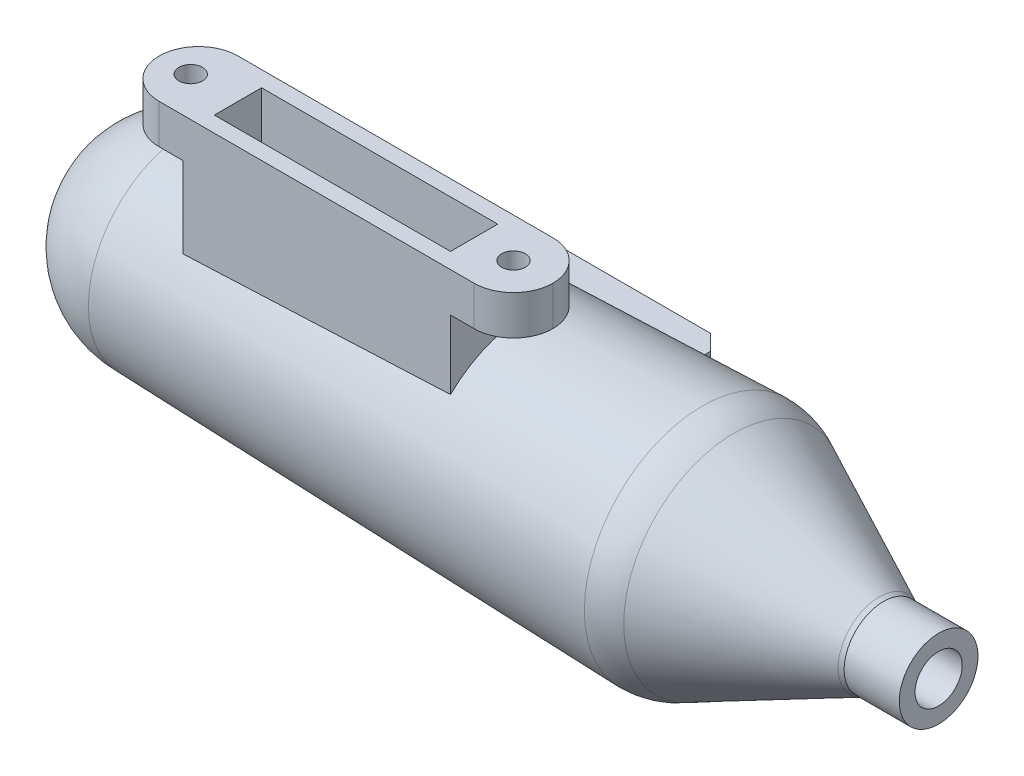
from build123d import *

# Parameters (mm, degrees)
BOSS_EXTRUDE1_REACH = 70.28
SKETCH2_W           = 34
SKETCH2_H           = 10
SKETCH2_W_2         = 30
SKETCH2_H_2         = 6
SKETCH4_W           = 30
SKETCH4_H           = 6
CUT_EXTRUDE4_DEPTH  = 20
SKETCH5_W           = 50
SKETCH5_H           = 10
SKETCH5_R           = 1.5
SKETCH5_W_2         = 30
SKETCH5_H_2         = 6
BOSS_EXTRUDE2_DEPTH = 5
FILLET1_R           = 5
BOSS_EXTRUDE3_REACH = 69.202
SKETCH6_W           = 49
SKETCH6_H           = 1
CHAMFER1_SIZE       = 2


with BuildPart() as part:
    # Sketch1 → Revolve1 (revolve)
    with BuildSketch(Plane.XY, mode=Mode.PRIVATE) as revolve1_sk:
        with BuildLine():
            Line((-41, 13), (24, 15))
            ThreePointArc((24, 15), (26.065530114, 14.762120457), (28, 14))
            Line((28, 14), (46.44629603, 5.214864416))
            ThreePointArc((46.44629603, 5.214864416), (46.719154543, 5.09714106), (47, 5))
            Line((47, 5), (54, 5))
            Line((54, 5), (54, 3))
            Line((54, 3), (52, 3))
            Line((52, 3), (47, 3))
            ThreePointArc((47, 3), (46.274186419, 3.139019493), (45.586334306, 3.409188411))
            Line((45.586334306, 3.409188411), (27.080850933, 12.222512247))
            ThreePointArc((27.080850933, 12.222512247), (25.614773207, 12.813149248), (24.045329018, 13.000448217))
            Line((24.045329018, 13.000448217), (-40.970521752, 10.999960501))
            ThreePointArc((-40.970521752, 10.999960501), (-48.767745467, 7.788589754), (-52, 0))
            Line((-52, 0), (-54, 0))
            ThreePointArc((-54, 0), (-50.192388155, 9.192388155), (-41, 13))
        make_face()
    revolve(revolve1_sk.sketch.rotate(Axis((54, 0, 0), (-1, 0, 0)), 90), axis=Axis((54, 0, 0), (-1, 0, 0)))

    # Boss-Extrude1: up to this cone (the profile starts outside it)
    boss_extrude1_end = Plane(origin=(-15, 0, 0), z_dir=(1, 0, 0)) * Cone(11.197538462, 16.402461538, 169.16, mode=Mode.PRIVATE)
    # Sketch2 → Boss-Extrude1 (add, up to the surface)
    with BuildSketch(Plane(origin=(0, 24, 0), x_dir=(1, 0, 0), z_dir=(0, 1, 0)), mode=Mode.PRIVATE) as boss_extrude1_sk1:
        with Locations((-15, -5)):
            Rectangle(SKETCH2_W, SKETCH2_H)
        with Locations((-15, -5)):
            Rectangle(SKETCH2_W_2, SKETCH2_H_2, mode=Mode.SUBTRACT)
    boss_extrude1_tool1 = extrude(boss_extrude1_sk1.sketch, amount=-BOSS_EXTRUDE1_REACH, mode=Mode.PRIVATE) - boss_extrude1_end
    add(boss_extrude1_tool1.solids().sort_by_distance((-15, 24, 0.354401))[0])

    # Sketch4 → Cut-Extrude4 (cut)
    with BuildSketch(Plane(origin=(0, 24, 0), x_dir=(1, 0, 0), z_dir=(0, 1, 0))):
        with Locations((-15, -5)):
            Rectangle(SKETCH4_W, SKETCH4_H)
    extrude(amount=-CUT_EXTRUDE4_DEPTH, mode=Mode.SUBTRACT)

    # Sketch5 → Boss-Extrude2 (add)
    with BuildSketch(Plane(origin=(0, 24, 0), x_dir=(1, 0, 0), z_dir=(0, 1, 0))):
        with Locations((-15, -5)):
            Rectangle(SKETCH5_W, SKETCH5_H)
        with Locations(Location((-36, -5, 0), (0, 0, 270))):
            Circle(SKETCH5_R, mode=Mode.SUBTRACT)
        with Locations(Location((5, -5, 0), (0, 0, 270))):
            Circle(SKETCH5_R, mode=Mode.SUBTRACT)
        with Locations((-15, -5)):
            Rectangle(SKETCH5_W_2, SKETCH5_H_2, mode=Mode.SUBTRACT)
    extrude(amount=-BOSS_EXTRUDE2_DEPTH)

    # Fillet1
    fillet1_edges = [part.edges().sort_by_distance(p)[0] for p in [
        (10, 21.5, 10),
        (10, 21.5, 0),
        (-40, 21.5, 0),
        (-40, 21.5, 10),
    ]]
    fillet(fillet1_edges, radius=FILLET1_R - 0.0001)  # a hair under: the kernel refuses the full size

    # Boss-Extrude3: up to this cone (the profile starts outside it)
    boss_extrude3_end = Plane(origin=(-14.5, 0, 0), z_dir=(1, 0, 0)) * Cone(11.245618935, 16.385150296, 167.034769231, mode=Mode.PRIVATE)
    # Sketch6 → Boss-Extrude3 (add, up to the surface)
    with BuildSketch(Plane.XY.offset(-17), mode=Mode.PRIVATE) as boss_extrude3_sk1:
        with Locations((-14.5, 6)):
            Rectangle(SKETCH6_W, SKETCH6_H)
    boss_extrude3_tool1 = extrude(boss_extrude3_sk1.sketch, amount=BOSS_EXTRUDE3_REACH, mode=Mode.PRIVATE) - boss_extrude3_end
    add(boss_extrude3_tool1.solids().sort_by_distance((-14.5, 6, -17))[0])
    # Sketch6 → Boss-Extrude3 (add, up to the surface)
    with BuildSketch(Plane.XY.offset(-17), mode=Mode.PRIVATE) as boss_extrude3_sk2:
        with Locations((-14.5, 3)):
            Rectangle(SKETCH6_W, SKETCH6_H)
    boss_extrude3_tool2 = extrude(boss_extrude3_sk2.sketch, amount=BOSS_EXTRUDE3_REACH, mode=Mode.PRIVATE) - boss_extrude3_end
    add(boss_extrude3_tool2.solids().sort_by_distance((-14.5, 3, -17))[0])
    # Sketch6 → Boss-Extrude3 (add, up to the surface)
    with BuildSketch(Plane.XY.offset(-17), mode=Mode.PRIVATE) as boss_extrude3_sk3:
        with Locations((-14.5, 0)):
            Rectangle(SKETCH6_W, SKETCH6_H)
    boss_extrude3_tool3 = extrude(boss_extrude3_sk3.sketch, amount=BOSS_EXTRUDE3_REACH, mode=Mode.PRIVATE) - boss_extrude3_end
    add(boss_extrude3_tool3.solids().sort_by_distance((-14.5, 0, -17))[0])
    # Sketch6 → Boss-Extrude3 (add, up to the surface)
    with BuildSketch(Plane.XY.offset(-17), mode=Mode.PRIVATE) as boss_extrude3_sk4:
        with Locations((-14.5, -3)):
            Rectangle(SKETCH6_W, SKETCH6_H)
    boss_extrude3_tool4 = extrude(boss_extrude3_sk4.sketch, amount=BOSS_EXTRUDE3_REACH, mode=Mode.PRIVATE) - boss_extrude3_end
    add(boss_extrude3_tool4.solids().sort_by_distance((-14.5, -3, -17))[0])
    # Sketch6 → Boss-Extrude3 (add, up to the surface)
    with BuildSketch(Plane.XY.offset(-17), mode=Mode.PRIVATE) as boss_extrude3_sk5:
        with Locations((-14.5, -6)):
            Rectangle(SKETCH6_W, SKETCH6_H)
    boss_extrude3_tool5 = extrude(boss_extrude3_sk5.sketch, amount=BOSS_EXTRUDE3_REACH, mode=Mode.PRIVATE) - boss_extrude3_end
    add(boss_extrude3_tool5.solids().sort_by_distance((-14.5, -6, -17))[0])

    # Chamfer1
    chamfer1_edges = [part.edges().sort_by_distance(p)[0] for p in [
        (10, 6, -17),
        (-39, 6, -17),
        (-39, 3, -17),
        (-39, 0, -17),
        (-39, -3, -17),
        (10, -6, -17),
        (-39, -6, -17),
    ]]
    chamfer(chamfer1_edges, length=CHAMFER1_SIZE)


solid = part.part
